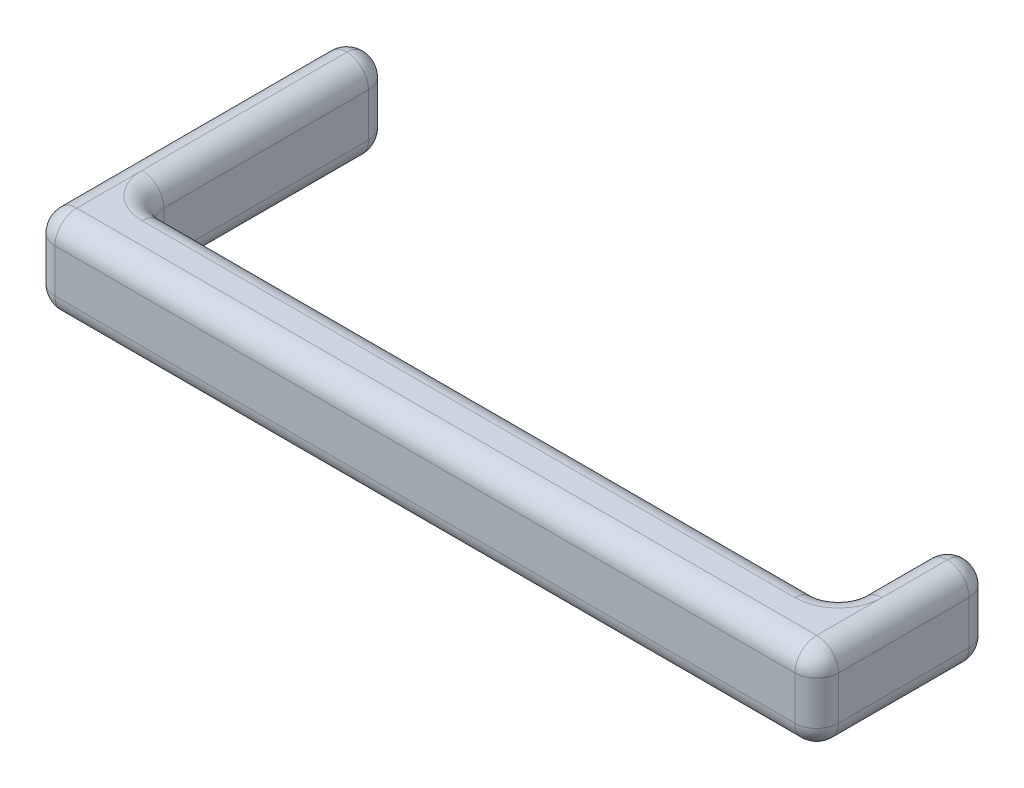
from build123d import *

# Parameters (mm, degrees)
SKETCH1_W           = 812.8
SKETCH1_H           = 101.6
BOSS_EXTRUDE1_DEPTH = 76.2
SKETCH2_W           = 50.8
SKETCH2_H           = 101.6
BOSS_EXTRUDE2_DEPTH = 203.2
SKETCH6_W           = 365.887
SKETCH6_H           = 101.6
BOSS_EXTRUDE5_DEPTH = 50.8
FILLET4_R           = 25.4


with BuildPart() as part:
    # Sketch1 → Boss-Extrude1 (new body)
    with BuildSketch(Plane.XY):
        with Locations((-406.4, 50.8)):
            Rectangle(SKETCH1_W, SKETCH1_H)
    extrude(amount=BOSS_EXTRUDE1_DEPTH)

    # Sketch2 → Boss-Extrude2 (add)
    with BuildSketch(Plane.XY.offset(76.2)):
        with Locations((-838.2, 50.8)):
            Rectangle(SKETCH2_W, SKETCH2_H)
        with Locations((25.4, 50.8)):
            Rectangle(SKETCH2_W, SKETCH2_H)
    extrude(amount=-BOSS_EXTRUDE2_DEPTH)

    # Sketch6 → Boss-Extrude5 (add)
    with BuildSketch(Plane.ZY.offset(863.6)):
        with Locations((-106.7435, 50.8)):
            Rectangle(SKETCH6_W, SKETCH6_H)
    extrude(amount=-BOSS_EXTRUDE5_DEPTH)

    # Fillet4
    fillet4_edges = [part.edges().sort_by_distance(p)[0] for p in [
        (-406.4, 0, 76.2),
        (-812.8, 101.6, -144.8435),
        (-863.6, 101.6, -106.7435),
        (-812.8, 0, -144.8435),
        (-863.6, 0, -106.7435),
        (-863.6, 50.8, 76.2),
        (25.4, 0, -127),
        (50.8, 0, -25.4),
        (0, 0, -63.5),
        (0, 50.8, -127),
        (0, 101.6, -63.5),
        (50.8, 50.8, 76.2),
        (50.8, 101.6, -25.4),
        (25.4, 101.6, -127),
        (50.8, 50.8, -127),
        (-838.2, 101.6, -289.687),
        (-863.6, 50.8, -289.687),
        (-812.8, 50.8, -289.687),
        (-838.2, 0, -289.687),
        (-406.4, 0, 0),
        (-812.8, 50.8, 0),
        (-406.4, 101.6, 0),
        (0, 50.8, 0),
        (-406.4, 101.6, 76.2),
    ]]
    fillet(fillet4_edges, radius=FILLET4_R - 0.0001)  # a hair under: the kernel refuses the full size


solid = part.part
